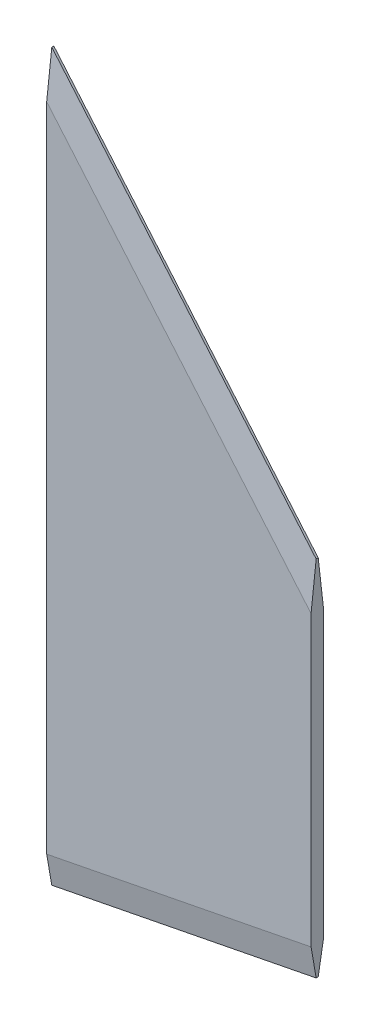
from build123d import *
from OCP.BRepFilletAPI import BRepFilletAPI_MakeChamfer

# Parameters (mm, degrees)
BOSS_EXTRUDE1_DEPTH = 1.5
CHAMFER1_SIZE       = 1.25
CHAMFER1_SIZE2      = 7.089102275


with BuildPart() as part:
    # Sketch1 → Boss-Extrude1 (new, symmetric)
    with BuildSketch(Plane.XY):
        Polygon((-60.98159975, 77.106512683), (-60.98159975, -100.693487317), (3.78840025, -87.993487317), (3.78840025, 0.906512683), align=None)
    extrude(amount=BOSS_EXTRUDE1_DEPTH, both=True)

    # Chamfer1: one chamfer whose edges measure the first distance from different faces: ONE call of the kernel's chamfer builder (chamfer() names one face for all edges)
    chamfer1_edges_1 = [part.edges().sort_by_distance(p)[0] for p in [
        (-28.59659975, -94.343487317, -1.5),
        (-28.59659975, -94.343487317, 1.5),
    ]]
    chamfer1_side_1 = [part.faces().sort_by_distance(p)[0] for p in [
        (-28.59659975, -94.343487317, 0),
    ]]
    chamfer1_edges_2 = [part.edges().sort_by_distance(p)[0] for p in [
        (-28.59659975, 39.006512683, -1.5),
        (-28.59659975, 39.006512683, 1.5),
    ]]
    chamfer1_side_2 = [part.faces().sort_by_distance(p)[0] for p in [
        (-28.59659975, 39.006512683, 0),
    ]]
    chamfer1 = BRepFilletAPI_MakeChamfer(part.part.solid().wrapped)
    for e in chamfer1_edges_1:
        chamfer1.Add(CHAMFER1_SIZE, CHAMFER1_SIZE2, e.wrapped, chamfer1_side_1[0].wrapped)  # the first distance lies on this face
    for e in chamfer1_edges_2:
        chamfer1.Add(CHAMFER1_SIZE, CHAMFER1_SIZE2, e.wrapped, chamfer1_side_2[0].wrapped)  # the first distance lies on this face
    add(Compound.cast(chamfer1.Shape()), mode=Mode.REPLACE)


solid = part.part
